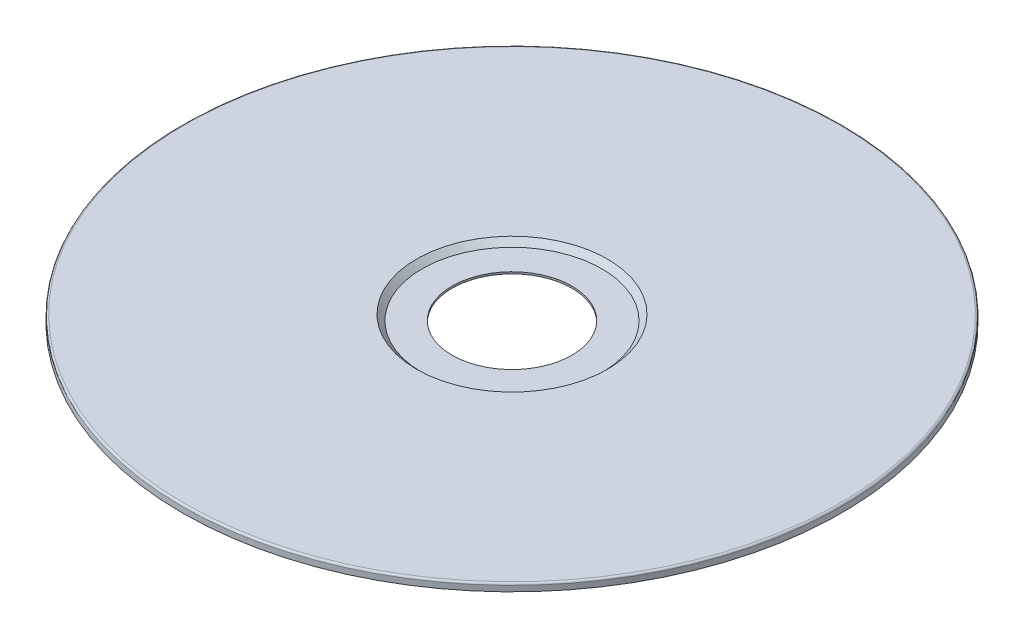
from build123d import *

# Parameters (mm, degrees)
SKETCH1_R           = 1117.6
SKETCH1_R_2         = 203.2
BOSS_EXTRUDE1_DEPTH = 25.4
SKETCH2_R           = 304.8
CUT_EXTRUDE1_DEPTH  = 19.05
CHAMFER1_SIZE       = 19.05
FILLET1_R           = 6.35


with BuildPart() as part:
    # Sketch1 → Boss-Extrude1 (new body)
    with BuildSketch(Plane(origin=(0, 0, 0), x_dir=(1, 0, 0), z_dir=(0, 1, 0))):
        with Locations(Location((0, 0, 0), (0, 0, 270))):
            Circle(SKETCH1_R)
        with Locations(Location((0, 0, 0), (0, 0, 270))):
            Circle(SKETCH1_R_2, mode=Mode.SUBTRACT)
    extrude(amount=BOSS_EXTRUDE1_DEPTH)

    # Sketch2 → Cut-Extrude1 (cut)
    with BuildSketch(Plane(origin=(0, 25.4, 0), x_dir=(1, 0, 0), z_dir=(0, 1, 0))):
        with Locations(Location((0, 0, 0), (0, 0, 270))):
            Circle(SKETCH2_R)
    extrude(amount=-CUT_EXTRUDE1_DEPTH, mode=Mode.SUBTRACT)

    # Chamfer1
    chamfer1_edges = [part.edges().sort_by_distance(p)[0] for p in [
        (0, 25.4, -304.8),
    ]]
    chamfer(chamfer1_edges, length=CHAMFER1_SIZE - 0.0001)  # a hair under: the kernel refuses the full size

    # Fillet1
    fillet1_edges = [part.edges().sort_by_distance(p)[0] for p in [
        (0, 25.4, -1117.6),
    ]]
    fillet(fillet1_edges, radius=FILLET1_R)


solid = part.part
